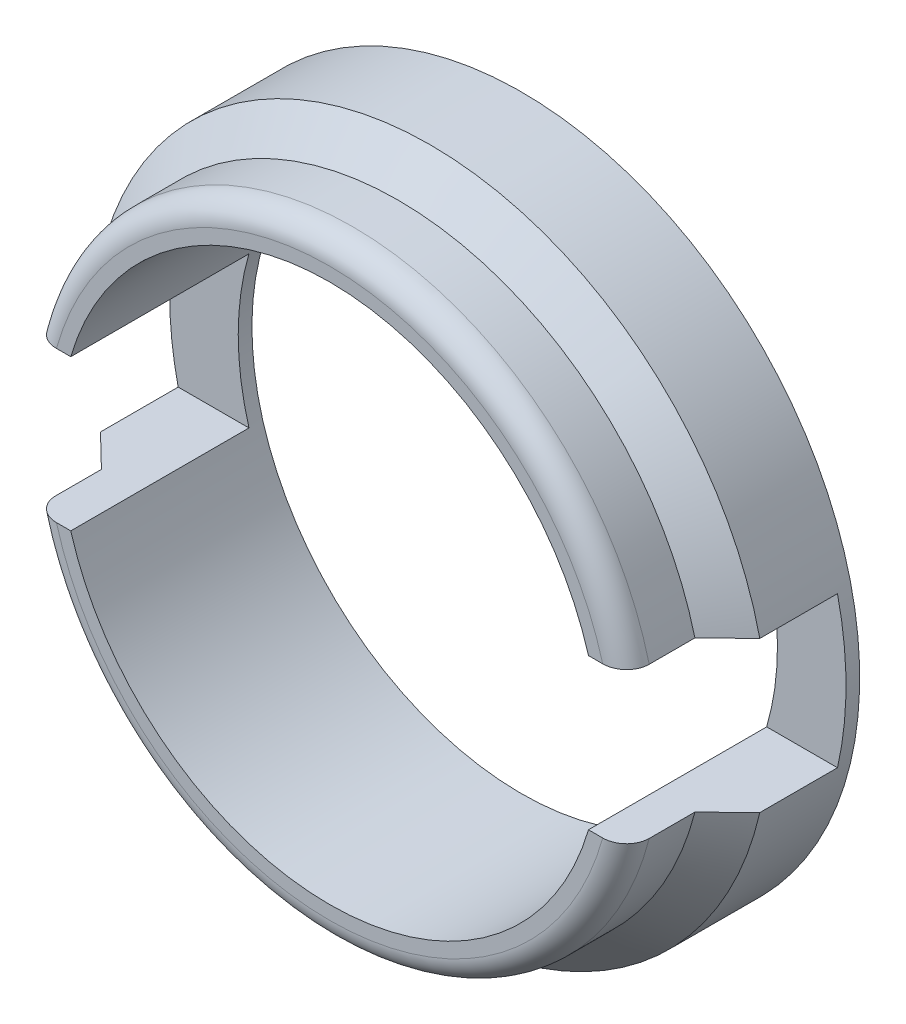
from build123d import *

# Parameters (mm, degrees)
CROQUIS1_R              = 6.7
CROQUIS1_R_2            = 5.9
SALIENTE_EXTRUIR1_DEPTH = 4.2
CROQUIS3_R              = 7.4
CROQUIS3_R_2            = 5.9
SALIENTE_EXTRUIR2_DEPTH = 2
REDONDEO1_R             = 0.5
CHAFL_N1_SIZE           = 0.7
CROQUIS2_W              = 20.515822
CROQUIS2_H              = 3.3
CORTAR_EXTRUIR1_DEPTH   = 3.9


with BuildPart() as part:
    # Croquis1 → Saliente-Extruir1 (new body)
    with BuildSketch(Plane.XY):
        Circle(CROQUIS1_R)
        Circle(CROQUIS1_R_2, mode=Mode.SUBTRACT)
    extrude(amount=SALIENTE_EXTRUIR1_DEPTH)

    # Croquis3 → Saliente-Extruir2 (add)
    with BuildSketch(Plane(origin=(0, 0, 0), x_dir=(-1, 0, 0), z_dir=(0, 0, -1))):
        Circle(CROQUIS3_R)
        with Locations(Location((0, 0, 0), (0, 0, 180))):
            Circle(CROQUIS3_R_2, mode=Mode.SUBTRACT)
    extrude(amount=-SALIENTE_EXTRUIR2_DEPTH)

    # Redondeo1
    redondeo1_edges = [part.edges().sort_by_distance(p)[0] for p in [
        (-6.7, 0, 4.2),
    ]]
    fillet(redondeo1_edges, radius=REDONDEO1_R)

    # Chaflán1
    chafl_n1_edges = [part.edges().sort_by_distance(p)[0] for p in [
        (-6.7, 0, 2),
    ]]
    chamfer(chafl_n1_edges, length=CHAFL_N1_SIZE - 0.0001)  # a hair under: the kernel refuses the full size

    # Croquis2 → Cortar-Extruir1 (cut)
    with BuildSketch(Plane.XY.offset(4.2)):
        Rectangle(CROQUIS2_W, CROQUIS2_H)
    extrude(amount=-CORTAR_EXTRUIR1_DEPTH, mode=Mode.SUBTRACT)


solid = part.part
